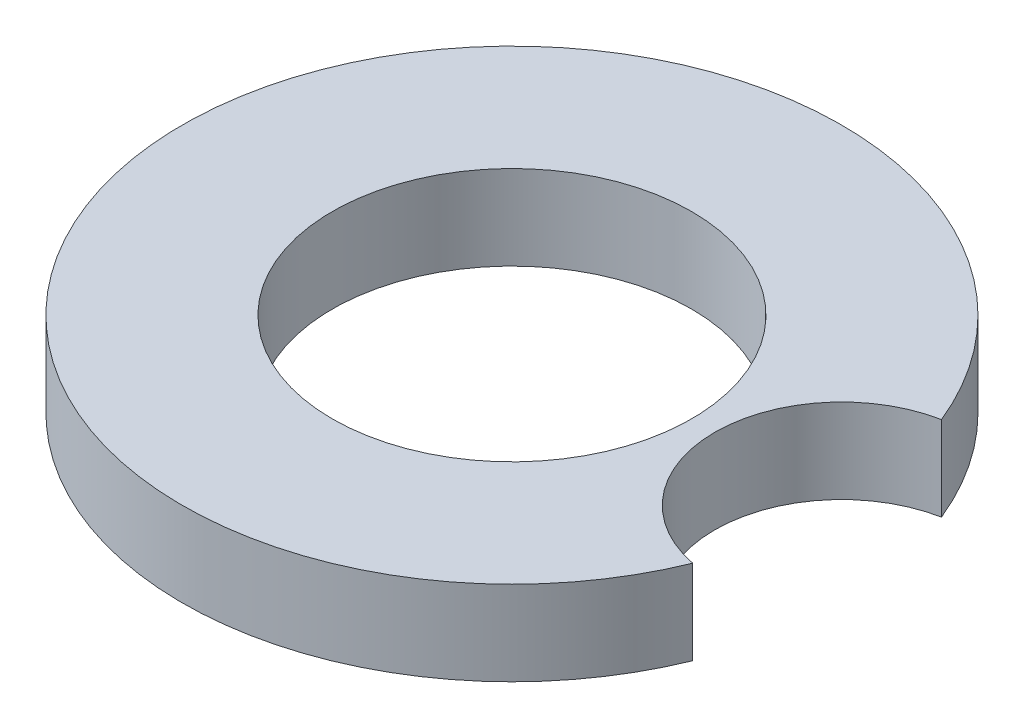
from build123d import *

# Parameters (mm, degrees)
SKETCH1_R           = 49.53
BOSS_EXTRUDE1_DEPTH = 12.7
SKETCH1_10_R        = 26.999999975
CUT_EXTRUDE2_DEPTH  = 72.188003203
SKETCH2_R           = 19.05
CUT_EXTRUDE3_DEPTH  = 72.188003203


with BuildPart() as part:
    # Sketch1 → Boss-Extrude1 (new body)
    with BuildSketch(Plane(origin=(0, 0, 0), x_dir=(1, 0, 0), z_dir=(0, 1, 0))):
        Circle(SKETCH1_R)
    extrude(amount=BOSS_EXTRUDE1_DEPTH)

    # Sketch1<10> → Cut-Extrude2 (cut, through all)
    with BuildSketch(Plane(origin=(0, 0, 0), x_dir=(1, 0, 0), z_dir=(0, 1, 0))):
        Circle(SKETCH1_10_R)
    extrude(amount=CUT_EXTRUDE2_DEPTH, mode=Mode.SUBTRACT)

    # Sketch2 → Cut-Extrude3 (cut, through all)
    with BuildSketch(Plane(origin=(0, 12.7, 0), x_dir=(1, 0, 0), z_dir=(0, 1, 0))):
        with Locations((49.53, 0)):
            Circle(SKETCH2_R)
    extrude(amount=-CUT_EXTRUDE3_DEPTH, mode=Mode.SUBTRACT)


solid = part.part
